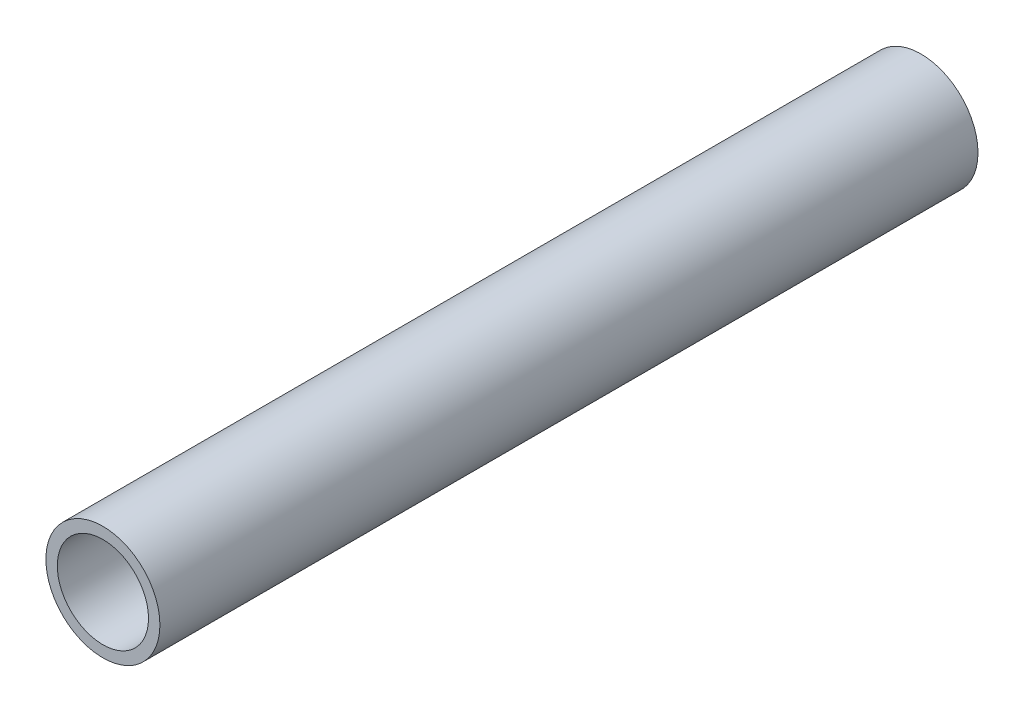
from build123d import *

# Parameters (mm, degrees)
SKETCH2_R           = 10
SKETCH2_R_2         = 8
BOSS_EXTRUDE1_DEPTH = 143.5


with BuildPart() as part:
    # Sketch2 → Boss-Extrude1 (new body)
    with BuildSketch(Plane.XY):
        Circle(SKETCH2_R)
        Circle(SKETCH2_R_2, mode=Mode.SUBTRACT)
    extrude(amount=BOSS_EXTRUDE1_DEPTH)


solid = part.part
